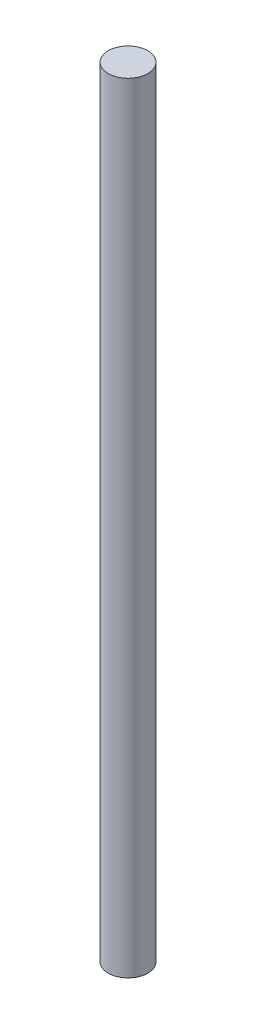
from build123d import *

# Parameters (mm, degrees)
SKETCH1_R       = 1.93499994
AXLE_BODY_DEPTH = 76.2


with BuildPart() as part:
    # Sketch1 → Axle Body (new body)
    with BuildSketch(Plane(origin=(0, 0, 0), x_dir=(1, 0, 0), z_dir=(0, 1, 0))):
        Circle(SKETCH1_R)
    extrude(amount=AXLE_BODY_DEPTH)


solid = part.part
